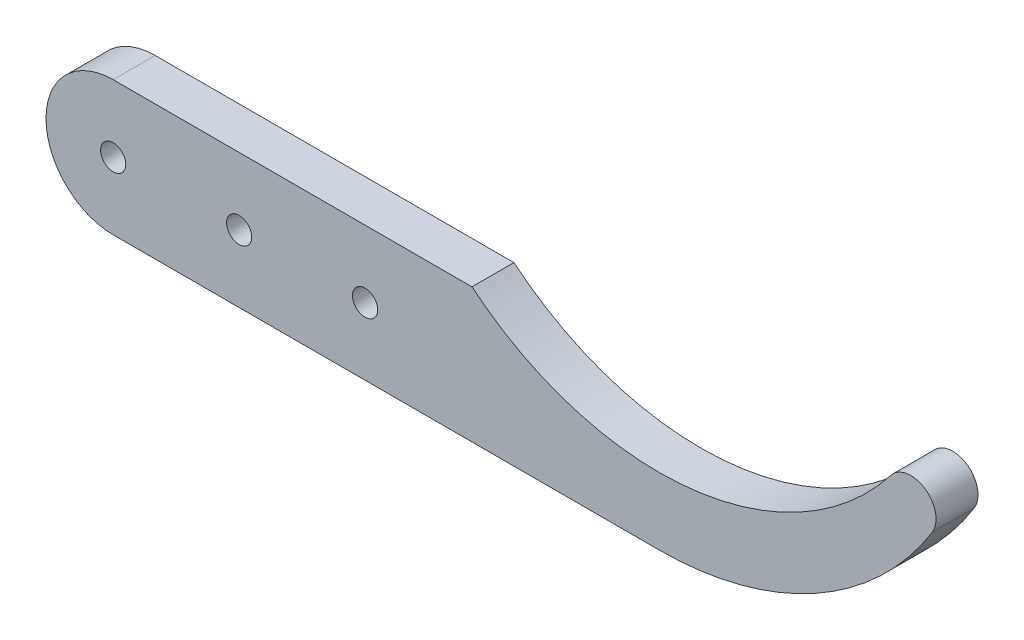
from build123d import *

# Parameters (mm, degrees)
ESQUISSE1_R        = 1.5
BOSS_EXTRU_1_DEPTH = 5


with BuildPart() as part:
    # Esquisse1 → Boss.-Extru.1 (new body)
    with BuildSketch(Plane.XY):
        with BuildLine():
            Line((0, 8), (20, 8))
            Line((20, 8), (27.728942549, 8))
            ThreePointArc((27.728942549, 8), (53.84637819, 0.211993808), (77.631578947, 13.517545651))
            ThreePointArc((77.631578947, 13.517545651), (81.714862069, 14.137746418), (82.547938522, 10.092522856))
            ThreePointArc((82.547938522, 10.092522856), (68.619262105, -3.172854276), (50, -8))
            Line((50, -8), (0, -8))
            Line((0, -8), (-15, -8))
            ThreePointArc((-15, -8), (-23, 0), (-15, 8))
            Line((-15, 8), (0, 8))
        make_face()
        Circle(ESQUISSE1_R, mode=Mode.SUBTRACT)
        with Locations((15, 0)):
            Circle(ESQUISSE1_R, mode=Mode.SUBTRACT)
        with Locations((-15, 0)):
            Circle(ESQUISSE1_R, mode=Mode.SUBTRACT)
    extrude(amount=BOSS_EXTRU_1_DEPTH)


solid = part.part
